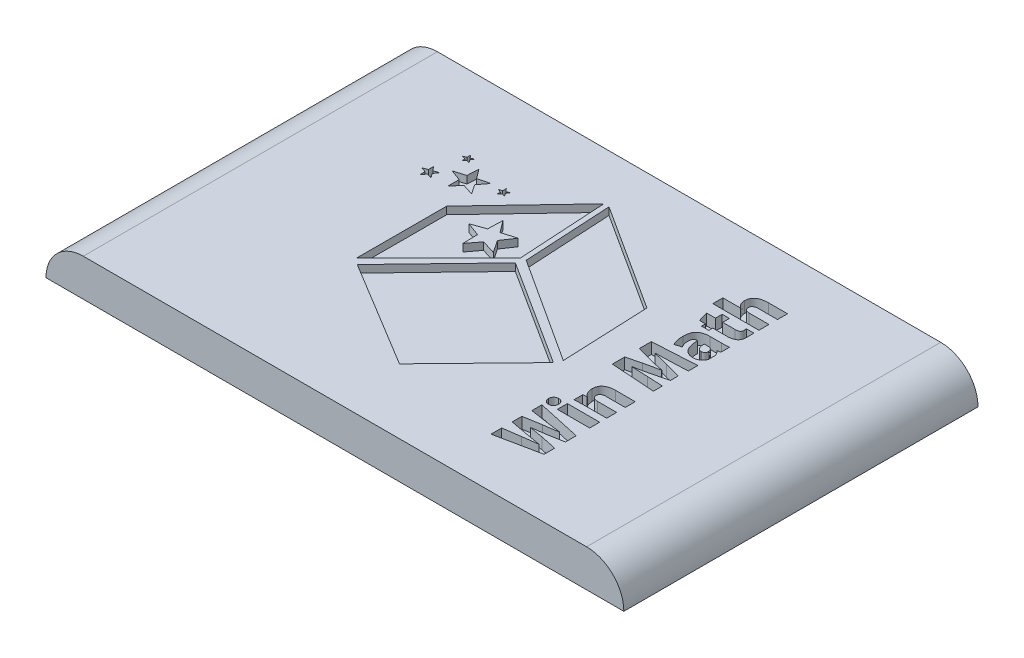
from build123d import *

# Parameters (mm, degrees)
SKETCH1_W           = 155
SKETCH1_H           = 95
BOSS_EXTRUDE1_DEPTH = 10
FILLET1_R           = 10
SHELL2_T            = -4
CUT_EXTRUDE2_DEPTH  = 2
SKETCH10_W          = 8.665288581
SKETCH10_H          = 2.686774754
CUT_EXTRUDE4_DEPTH  = 3
SKETCH15_W          = 8.5
SKETCH15_H          = 2.5
BOSS_EXTRUDE4_DEPTH = 8


with BuildPart() as part:
    # Sketch1 → Boss-Extrude1 (new body)
    with BuildSketch(Plane(origin=(0, 0, 0), x_dir=(1, 0, 0), z_dir=(0, 1, 0))):
        with Locations((77.5, 47.5)):
            Rectangle(SKETCH1_W, SKETCH1_H)
    extrude(amount=BOSS_EXTRUDE1_DEPTH)

    # Fillet1
    fillet1_edges = [part.edges().sort_by_distance(p)[0] for p in [
        (0, 10, -47.5),
        (155, 10, -47.5),
    ]]
    fillet(fillet1_edges, radius=FILLET1_R - 0.0001)  # a hair under: the kernel refuses the full size

    # Shell2
    shell2_openings = [part.faces().sort_by_distance(p)[0] for p in [
        (77.5, 0, -47.5),
    ]]
    offset(amount=SHELL2_T, openings=shell2_openings, kind=Kind.INTERSECTION)

    # Sketch3 → Cut-Extrude2 (cut)
    # profile 1 of 7: a face of its own
    with BuildSketch(Plane(origin=(0, 10, 0), x_dir=(1, 0, 0), z_dir=(0, 1, 0))):
        Polygon((69.036733179, 58.259922124), (67.638125215, 81.983150461), (47.110875028, 60.376853373), (47.083310819, 36.243745248), align=None)
        Polygon((60.375139911, 61.38680599), (58.007558121, 64.596933768), (57.882600374, 60.574029348), (54.174295459, 59.25664392), (57.866061848, 57.891664292), (57.941771542, 53.867289781), (60.348494509, 57.046729406), (64.103658579, 55.876904377), (61.899073145, 59.206844583), (64.144269846, 62.508118011), align=None, mode=Mode.SUBTRACT)
    # profile 2 of 7: a face of its own
    with BuildSketch(Plane(origin=(0, 10, 0), x_dir=(1, 0, 0), z_dir=(0, 1, 0))):
        Polygon((97.7621304, 38.336052471), (69.493012718, 56.405769666), (48.678543473, 34.808385006), (77.418274083, 17.397360525), align=None)
    # profile 3 of 7: a face of its own
    with BuildSketch(Plane(origin=(0, 10, 0), x_dir=(1, 0, 0), z_dir=(0, 1, 0))):
        Polygon((97.616775138, 63.57760932), (69.036733179, 81.982047892), (70.347319435, 58.462059656), (98.617355923, 40.151431275), align=None)
    # profile 4 of 7: a face of its own
    with BuildSketch(Plane(origin=(0, 10, 0), x_dir=(1, 0, 0), z_dir=(0, 1, 0))):
        Polygon((38.36475152, 67.166469328), (37.026417293, 66.737570237), (36.147854072, 67.834441993), (36.142157469, 66.429218619), (34.827528462, 65.932327812), (36.162371222, 65.492770559), (36.228525324, 64.089017277), (37.059126821, 65.222641311), (38.414734619, 64.85181082), (37.59313743, 65.992050265), align=None)
    # profile 5 of 7: a face of its own
    with BuildSketch(Plane(origin=(0, 10, 0), x_dir=(1, 0, 0), z_dir=(0, 1, 0))):
        Polygon((39.932787488, 75.007200453), (39.063779859, 74.697011221), (38.463798911, 75.398060936), (38.49007679, 74.475762504), (37.63797521, 74.12183806), (38.523337602, 73.861815689), (38.596658398, 72.942089916), (39.117438186, 73.70359713), (40.01492883, 73.489147584), (39.451516399, 74.219966644), align=None)
    # profile 6 of 7: a face of its own
    with BuildSketch(Plane(origin=(0, 10, 0), x_dir=(1, 0, 0), z_dir=(0, 1, 0))):
        Polygon((47.773334851, 71.559101671), (44.716464075, 70.785833729), (42.872969779, 73.252830432), (42.69380242, 70.220583683), (39.682136947, 69.298101489), (42.628199603, 68.197370744), (42.610558509, 65.160162438), (44.610433751, 67.51230827), (47.611257302, 66.557484071), (45.901173777, 69.111767437), align=None)
    # profile 7 of 7: a face of its own
    with BuildSketch(Plane(origin=(0, 10, 0), x_dir=(1, 0, 0), z_dir=(0, 1, 0))):
        Polygon((52.540289151, 71.996453787), (51.629200164, 71.701332989), (51.028116647, 72.447036723), (51.027014078, 71.489272342), (50.132096093, 71.148027435), (51.042633797, 70.851069023), (51.09059552, 69.894590972), (51.654375475, 70.668777721), (52.579062805, 70.418678465), (52.016936703, 71.194151544), align=None)
    extrude(amount=-CUT_EXTRUDE2_DEPTH, mode=Mode.SUBTRACT)

    # Sketch10 → Cut-Extrude4 (cut)
    # profile 1 of 8: a face of its own
    with BuildSketch(Plane(origin=(0, 10, 0), x_dir=(1, 0, 0), z_dir=(0, 1, 0))):
        with BuildLine():
            Line((109.792253149, 20.176323529), (109.79434915, 20.208015488))
            add(Edge.make_bspline(
                [(109.79434915, 20.208015488), (110.455705602, 20.281837374), (111.701269567, 20.424818801), (112.938874379, 20.625319094), (113.517703543, 20.727912603)],
                knots=[0, 0, 0, 0, 0.530977497, 1, 1, 1, 1], degree=3))
            Line((113.517703543, 20.727912603), (117.821434976, 21.525285399))
            Line((117.821434976, 21.525285399), (117.821434976, 24.404898692))
            Line((117.821434976, 24.404898692), (106.024546087, 26.993337369))
            Line((106.024546087, 26.993337369), (106.024546087, 24.297679048))
            Line((106.024546087, 24.297679048), (110.60316198, 23.593092817))
            add(Edge.make_bspline(
                [(110.60316198, 23.593092817), (111.28756685, 23.486706293), (112.663408575, 23.281734449), (114.044582989, 23.116263812), (114.738761612, 23.041028071)],
                knots=[0, 0, 0, 0, 0.497983353, 1, 1, 1, 1], degree=3))
            Line((114.738761612, 23.041028071), (114.738789849, 22.995726229))
            add(Edge.make_bspline(
                [(114.738789849, 22.995726229), (114.055513772, 22.92090247), (112.703388907, 22.754808184), (111.358226834, 22.539672346), (110.693033692, 22.427162812)],
                knots=[0, 0, 0, 0, 0.504666049, 1, 1, 1, 1], degree=3))
            Line((110.693033692, 22.427162812), (106.024546087, 21.632505042))
            Line((106.024546087, 21.632505042), (106.024546087, 19.028599405))
            Line((106.024546087, 19.028599405), (110.60316198, 18.170842253))
            add(Edge.make_bspline(
                [(110.60316198, 18.170842253), (111.304504593, 18.031314883), (112.690614667, 17.778181648), (114.081120008, 17.550417142), (114.767675556, 17.449516256)],
                knots=[0, 0, 0, 0, 0.507508313, 1, 1, 1, 1], degree=3))
            Line((114.767675556, 17.449516256), (114.769311088, 17.420304746))
            add(Edge.make_bspline(
                [(114.769311088, 17.420304746), (114.089540121, 17.329446689), (112.708978219, 17.164177801), (111.33035263, 16.983234878), (110.632981656, 16.882358136)],
                knots=[0, 0, 0, 0, 0.493234208, 1, 1, 1, 1], degree=3))
            Line((110.632981656, 16.882358136), (106.024546087, 16.210254479))
            Line((106.024546087, 16.210254479), (106.024546087, 13.345958277))
            Line((106.024546087, 13.345958277), (117.821434976, 15.781375903))
            Line((117.821434976, 15.781375903), (117.821434976, 18.630355013))
            Line((117.821434976, 18.630355013), (113.533200913, 19.53406344))
            add(Edge.make_bspline(
                [(113.533200913, 19.53406344), (112.944916379, 19.658403301), (111.700237893, 19.887823747), (110.448822737, 20.076287318), (109.792253149, 20.176323529)],
                knots=[0, 0, 0, 0, 0.475130786, 1, 1, 1, 1], degree=3))
        make_face()
    # profile 2 of 8: a face of its own
    with BuildSketch(Plane(origin=(0, 10, 0), x_dir=(1, 0, 0), z_dir=(0, 1, 0))):
        with Locations((113.488790686, 29.350939085)):
            Rectangle(SKETCH10_W, SKETCH10_H)
    # profile 3 of 8: a face of its own
    with BuildSketch(Plane(origin=(0, 10, 0), x_dir=(1, 0, 0), z_dir=(0, 1, 0))):
        with BuildLine():
            add(Edge.make_bspline(
                [(106.805220386, 27.976415787), (106.986061008, 27.977822156), (107.253592713, 28.023648032), (107.567661556, 28.187355383), (107.765897596, 28.353565551), (107.929362554, 28.556446918), (108.094524678, 28.881879168), (108.138027835, 29.160217386), (108.141934229, 29.348716021)],
                knots=[0, 0, 0, 0, 0.253740779, 0.372231841, 0.492472327, 0.613664901, 0.734924241, 1, 1, 1, 1], degree=3))
            add(Edge.make_bspline(
                [(108.141934229, 29.348716021), (108.13880655, 29.533270492), (108.096944726, 29.807520735), (107.935431471, 30.129362769), (107.776703927, 30.335314971), (107.581541982, 30.506119997), (107.263310189, 30.674196047), (106.990549885, 30.720387643), (106.805220386, 30.723240406)],
                knots=[0, 0, 0, 0, 0.25927437, 0.379931763, 0.500522204, 0.621179596, 0.740025125, 1, 1, 1, 1], degree=3))
            Line((106.805220386, 30.723240406), (106.805974077, 30.725073591))
            add(Edge.make_bspline(
                [(106.805974077, 30.725073591), (106.619769652, 30.722432926), (106.345614811, 30.676852306), (106.02365478, 30.513527127), (105.824394706, 30.346684429), (105.66369677, 30.142401273), (105.496623558, 29.817909321), (105.459349625, 29.537012114), (105.455161646, 29.348716021)],
                knots=[0, 0, 0, 0, 0.2589006, 0.37811166, 0.497229398, 0.61664906, 0.736776138, 1, 1, 1, 1], degree=3))
            add(Edge.make_bspline(
                [(105.455161646, 29.348716021), (105.457261626, 29.163239942), (105.49996557, 28.887414163), (105.662821208, 28.56419842), (105.825122001, 28.359638182), (106.023423767, 28.190763568), (106.344476473, 28.023833767), (106.619622842, 27.980368616), (106.805220386, 27.976415787)],
                knots=[0, 0, 0, 0, 0.259051438, 0.380497729, 0.500313379, 0.62048887, 0.740571173, 1, 1, 1, 1], degree=3))
        make_face()
    # profile 4 of 8: a face of its own
    with BuildSketch(Plane(origin=(0, 10, 0), x_dir=(1, 0, 0), z_dir=(0, 1, 0))):
        with BuildLine():
            add(Edge.make_bspline(
                [(112.675048454, 35.249384615), (112.545592685, 35.254083647), (112.358164524, 35.266459945), (112.11897095, 35.30773926), (111.962345757, 35.353847084), (111.817654345, 35.402802292), (111.69014682, 35.467985533), (111.578160491, 35.544444168), (111.449077873, 35.65508887), (111.322618833, 35.813202152), (111.168692328, 36.08130507), (111.127177909, 36.310044681), (111.131191142, 36.459321937)],
                knots=[0, 0, 0, 0, 0.176160203, 0.255052732, 0.32940979, 0.397964722, 0.462432765, 0.523384479, 0.581990358, 0.692990545, 0.796775826, 1, 1, 1, 1], degree=3))
            add(Edge.make_bspline(
                [(111.131191142, 36.459321937), (111.130080554, 36.551719086), (111.149455225, 36.685474085), (111.196776502, 36.854289303), (111.245508535, 36.966210513), (111.309199314, 37.066906868), (111.388244937, 37.15484283), (111.476493028, 37.236832085), (111.618621342, 37.326092923), (111.819718874, 37.417224497), (112.198755715, 37.526849864), (112.508141007, 37.544872591), (112.721458026, 37.542482738)],
                knots=[0, 0, 0, 0, 0.126622383, 0.185047078, 0.240764724, 0.293960579, 0.34817347, 0.403063393, 0.459078996, 0.578190241, 0.705688236, 1, 1, 1, 1], degree=3))
            Line((112.721458026, 37.542482738), (117.821434976, 37.544704716))
            Line((117.821434976, 37.544704716), (117.821434976, 40.231477298))
            Line((117.821434976, 40.231477298), (112.542342316, 40.231477298))
            add(Edge.make_bspline(
                [(112.542342316, 40.231477298), (112.271694274, 40.228814628), (111.876870415, 40.210287954), (111.371079382, 40.135138358), (111.03008149, 40.056916336), (110.713406466, 39.960581933), (110.423877439, 39.836935416), (110.157264958, 39.695648606), (109.917397892, 39.53021761), (109.705813967, 39.343075167), (109.520504268, 39.136145519), (109.364113599, 38.908243319), (109.236530712, 38.658276513), (109.136734704, 38.38879388), (109.038695349, 37.991714977), (109.016212867, 37.678195288), (109.013800828, 37.464637506)],
                knots=[0, 0, 0, 0, 0.159329229, 0.232136671, 0.30061145, 0.365052216, 0.426635428, 0.485584623, 0.542342679, 0.597667459, 0.65143417, 0.705405814, 0.759844481, 0.816166583, 0.874152162, 1, 1, 1, 1], degree=3))
            add(Edge.make_bspline(
                [(109.013800828, 37.464637506), (109.020960497, 37.176646894), (109.068776347, 36.758517506), (109.228474953, 36.239449525), (109.393422488, 35.90820579), (109.582351423, 35.619084927), (109.837026659, 35.296892327), (110.051657569, 35.092358342), (110.210393253, 34.989159125)],
                knots=[0, 0, 0, 0, 0.302903009, 0.439447221, 0.568754019, 0.690453447, 0.80194042, 1, 1, 1, 1], degree=3))
            Line((110.210393253, 34.989159125), (110.211238169, 34.943944164))
            Line((110.211238169, 34.943944164), (109.156146395, 34.806559493))
            Line((109.156146395, 34.806559493), (109.156146395, 32.501115603))
            add(Edge.make_bspline(
                [(109.156146395, 32.501115603), (109.590425563, 32.519694425), (110.513312872, 32.549172218), (111.436628561, 32.556742971), (111.925212509, 32.560387883)],
                knots=[0, 0, 0, 0, 0.470792845, 1, 1, 1, 1], degree=3))
            Line((111.925212509, 32.560387883), (117.821434976, 32.562609861))
            Line((117.821434976, 32.562609861), (117.821434976, 35.249384615))
            Line((117.821434976, 35.249384615), (112.675048454, 35.249384615))
        make_face()
    # profile 5 of 8: a face of its own
    with BuildSketch(Plane(origin=(0, 10, 0), x_dir=(1, 0, 0), z_dir=(0, 1, 0))):
        with BuildLine():
            Line((109.26735387, 54.147982822), (109.267358214, 54.194844175))
            add(Edge.make_bspline(
                [(109.267358214, 54.194844175), (110.031851514, 54.183899405), (110.979533008, 54.199987074), (112.102462916, 54.236006327), (112.791228623, 54.263308822), (113.297002921, 54.281479358), (113.626686868, 54.301449137)],
                knots=[0, 0, 0, 0, 0.525845663, 0.651876005, 0.772827643, 1, 1, 1, 1], degree=3))
            Line((113.626686868, 54.301449137), (117.821434976, 54.471568337))
            Line((117.821434976, 54.471568337), (117.821434976, 57.023580049))
            Line((117.821434976, 57.023580049), (106.024546087, 56.34714321))
            Line((106.024546087, 56.34714321), (106.024546087, 53.087947529))
            Line((106.024546087, 53.087947529), (109.824870388, 52.073292269))
            add(Edge.make_bspline(
                [(109.824870388, 52.073292269), (110.529476101, 51.888337292), (111.939558008, 51.555824805), (113.358062051, 51.261204048), (114.067068467, 51.134260265)],
                knots=[0, 0, 0, 0, 0.50283341, 1, 1, 1, 1], degree=3))
            Line((114.067068467, 51.134260265), (114.067322593, 51.074010575))
            add(Edge.make_bspline(
                [(114.067322593, 51.074010575), (113.362421965, 50.946770089), (111.946456926, 50.673341755), (110.543177199, 50.340924297), (109.838960289, 50.166755237)],
                knots=[0, 0, 0, 0, 0.496826679, 1, 1, 1, 1], degree=3))
            Line((109.838960289, 50.166755237), (106.024546087, 49.213809266))
            Line((106.024546087, 49.213809266), (106.024546087, 45.908492891))
            Line((106.024546087, 45.908492891), (117.821434976, 45.093693971))
            Line((117.821434976, 45.093693971), (117.821434976, 47.522717167))
            Line((117.821434976, 47.522717167), (113.624764629, 47.722573506))
            add(Edge.make_bspline(
                [(113.624764629, 47.722573506), (113.291081067, 47.739633209), (112.778701358, 47.76442947), (112.079445197, 47.796373432), (110.960834778, 47.845039884), (110.020772475, 47.882729754), (109.26735387, 47.907019356)],
                knots=[0, 0, 0, 0, 0.229826594, 0.352856511, 0.481490482, 1, 1, 1, 1], degree=3))
            Line((109.26735387, 47.907019356), (109.267358214, 47.953176974))
            add(Edge.make_bspline(
                [(109.267358214, 47.953176974), (110.00310407, 48.078921568), (110.915641298, 48.251507349), (111.99256358, 48.48470057), (112.647171752, 48.633870138), (113.122429657, 48.750419415), (113.428737564, 48.827817245)],
                knots=[0, 0, 0, 0, 0.526467698, 0.654878301, 0.777163486, 1, 1, 1, 1], degree=3))
            Line((113.428737564, 48.827817245), (117.608728961, 49.890246106))
            Line((117.608728961, 49.890246106), (117.608728961, 51.934930189))
            Line((117.608728961, 51.934930189), (113.40018852, 53.103321093))
            add(Edge.make_bspline(
                [(113.40018852, 53.103321093), (113.09218646, 53.187583927), (112.618236743, 53.322253707), (111.964176369, 53.494922928), (110.897489299, 53.770856536), (109.994492018, 53.987285463), (109.26735387, 54.147982822)],
                knots=[0, 0, 0, 0, 0.224698707, 0.3466845, 0.476000013, 1, 1, 1, 1], degree=3))
        make_face()
    # profile 6 of 8: a face of its own
    with BuildSketch(Plane(origin=(0, 10, 0), x_dir=(1, 0, 0), z_dir=(0, 1, 0))):
        with BuildLine():
            Line((117.830329402, 59.932627318), (117.830329402, 61.650844989))
            add(Edge.make_bspline(
                [(117.830329402, 61.650844989), (117.82532285, 61.669162698), (117.79066929, 61.791216765), (117.711394308, 62.011134496), (117.572338443, 62.300375877), (117.335480737, 62.65702212), (117.105348287, 62.884043774), (116.936221307, 63.015666834)],
                knots=[0.36328456, 0.36328456, 0.36328456, 0.36328456, 0.385125259, 0.509211321, 0.631645188, 0.753459676, 1, 1, 1, 1], degree=3))
            Line((116.936221307, 63.015666834), (116.937316006, 63.060781882))
            Line((116.937316006, 63.060781882), (117.821434976, 63.20958704))
            Line((117.821434976, 63.20958704), (117.821434976, 65.565004789))
            add(Edge.make_bspline(
                [(117.821434976, 65.565004789), (117.677748996, 65.532163273), (117.45008879, 65.505542481), (117.136179932, 65.468259837), (116.592709894, 65.435339063), (116.13058889, 65.423049614), (115.755197929, 65.424420731)],
                knots=[0, 0, 0, 0, 0.212741013, 0.331399044, 0.457156632, 1, 1, 1, 1], degree=3))
            Line((115.755197929, 65.424420731), (112.694555374, 65.426642708))
            add(Edge.make_bspline(
                [(112.694555374, 65.426642708), (112.452530809, 65.434159901), (112.095692675, 65.418463568), (111.631074397, 65.354689924), (111.303177964, 65.27682039), (110.986496412, 65.18126981), (110.684928813, 65.055097347), (110.397210759, 64.905288847), (110.121697305, 64.73348242), (109.867107918, 64.527318082), (109.647017857, 64.275450648), (109.458671366, 63.983410388), (109.306707721, 63.647419935), (109.181476391, 63.272095723), (109.058022402, 62.690464358), (109.019301911, 62.228346234), (109.013800828, 61.908040389)],
                knots=[0, 0, 0, 0, 0.124012428, 0.182748926, 0.240082173, 0.296571819, 0.352108958, 0.407344988, 0.462689397, 0.518300585, 0.574566128, 0.633380012, 0.695774865, 0.763066447, 0.835812544, 1, 1, 1, 1], degree=3))
            add(Edge.make_bspline(
                [(109.013800828, 61.908040389), (109.015679391, 61.553365409), (109.04899114, 61.042265614), (109.147480471, 60.392925131), (109.248703859, 59.971983886), (109.362089165, 59.598130719), (109.505831819, 59.190259845), (109.628820673, 58.914352892), (109.721080366, 58.751972264)],
                knots=[0, 0, 0, 0, 0.325720809, 0.469837241, 0.602829046, 0.723064519, 0.828626239, 1, 1, 1, 1], degree=3))
            Line((109.721080366, 58.751972264), (111.440382673, 59.232529735))
            add(Edge.make_bspline(
                [(111.440382673, 59.232529735), (111.345896835, 59.370851893), (111.23077079, 59.600112903), (111.095386116, 59.921160043), (111.009948317, 60.184042204), (110.937641611, 60.459169621), (110.870383654, 60.848191013), (110.844604617, 61.147145077), (110.846500007, 61.349778867)],
                knots=[0, 0, 0, 0, 0.224854409, 0.344804783, 0.468872013, 0.596717397, 0.727529605, 1, 1, 1, 1], degree=3))
            add(Edge.make_bspline(
                [(110.846500007, 61.349778867), (110.845002059, 61.478683355), (110.861151736, 61.662658777), (110.891071404, 61.897924383), (110.931159349, 62.048638001), (110.973011064, 62.185646734), (111.029930066, 62.304432794), (111.093366386, 62.408010559), (111.192659926, 62.521254593), (111.338539735, 62.632903288), (111.612852236, 62.763799334), (111.846481484, 62.791396093), (112.003057741, 62.784355287)],
                knots=[0, 0, 0, 0, 0.18180892, 0.261271409, 0.334748632, 0.4020433, 0.463473156, 0.520477115, 0.573236162, 0.675566172, 0.777783362, 1, 1, 1, 1], degree=3))
            add(Edge.make_bspline(
                [(112.003057741, 62.784355287), (112.005872912, 62.46598577), (112.023717046, 61.997030976), (112.108619723, 61.391142913), (112.194973938, 60.968982144), (112.306268574, 60.569840406), (112.440935677, 60.191899637), (112.605122928, 59.838466836), (112.786577984, 59.50514766), (113.000190998, 59.204598774), (113.241166768, 58.937890227), (113.515870857, 58.714056161), (113.818406976, 58.528712685), (114.148966602, 58.379619268), (114.643171298, 58.235640091), (115.03666983, 58.189485659), (115.305919732, 58.182589995)],
                knots=[0, 0, 0, 0, 0.149723135, 0.220091132, 0.287334086, 0.352092728, 0.414697941, 0.475660325, 0.535089834, 0.592810356, 0.64854798, 0.703513505, 0.758732465, 0.814879192, 0.873418456, 1, 1, 1, 1], degree=3))
            add(Edge.make_bspline(
                [(115.305919732, 58.182589995), (115.483525464, 58.182696346), (115.7454589, 58.208803996), (116.084043465, 58.2822751), (116.32203826, 58.361803657), (116.551122913, 58.456351589), (116.767016043, 58.575698198), (116.973510996, 58.713648069), (117.164661403, 58.874143678), (117.344815122, 59.047430592), (117.496920086, 59.243687236), (117.632943394, 59.450284264), (117.741011701, 59.674578232), (117.801481723, 59.837925101), (117.828140388, 59.92532548), (117.830329402, 59.932627318)],
                knots=[0, 0, 0, 0, 0.130267071, 0.192750794, 0.254048942, 0.314320404, 0.374505722, 0.434912302, 0.496401197, 0.55761949, 0.618080033, 0.678341656, 0.738976024, 0.800474561, 0.806071913, 0.806071913, 0.806071913, 0.806071913], degree=3))
        make_face()
        with BuildLine():
            add(Edge.make_bspline(
                [(114.998987103, 60.72924116), (114.885701581, 60.734976325), (114.717911461, 60.752195692), (114.514427454, 60.828817609), (114.376709031, 60.895835623), (114.254805659, 60.987877229), (114.146278605, 61.096420323), (114.050832911, 61.223563923), (113.944614143, 61.420483832), (113.840446456, 61.69772586), (113.712599355, 62.199880454), (113.691620967, 62.603730108), (113.693411353, 62.879993715)],
                knots=[0, 0, 0, 0, 0.121062784, 0.176330044, 0.230178356, 0.28306346, 0.337597475, 0.392685149, 0.451159481, 0.574502558, 0.706010805, 1, 1, 1, 1], degree=3))
            Line((113.693411353, 62.879993715), (114.802152045, 62.882215693))
            add(Edge.make_bspline(
                [(114.802152045, 62.882215693), (114.980226975, 62.873449849), (115.243734036, 62.833107212), (115.537963673, 62.661356786), (115.706796163, 62.496656244), (115.836916364, 62.307447966), (115.963373397, 62.037327168), (116.00504686, 61.817266342), (116.002078522, 61.670056393)],
                knots=[0, 0, 0, 0, 0.283588896, 0.408331003, 0.531556683, 0.652548379, 0.76868481, 1, 1, 1, 1], degree=3))
            add(Edge.make_bspline(
                [(116.002078522, 61.670056393), (116.003987112, 61.54945225), (115.976701469, 61.368880763), (115.87311336, 61.15239919), (115.765266924, 61.00877971), (115.625868827, 60.884314351), (115.371497374, 60.7628411), (115.151911641, 60.732085831), (114.998987103, 60.72924116)],
                knots=[0, 0, 0, 0, 0.233316155, 0.346154559, 0.460826239, 0.578678938, 0.703680602, 1, 1, 1, 1], degree=3))
        make_face(mode=Mode.SUBTRACT)
    # profile 7 of 8: a face of its own
    with BuildSketch(Plane(origin=(0, 10, 0), x_dir=(1, 0, 0), z_dir=(0, 1, 0))):
        with BuildLine():
            Line((117.830329402, 69.494003369), (117.830329402, 71.871472104))
            add(Edge.make_bspline(
                [(117.830329402, 71.871472104), (117.813971873, 71.945847501), (117.795064678, 72.019648169), (117.772501515, 72.092420898)],
                knots=[0.863627378, 0.863627378, 0.863627378, 0.863627378, 1, 1, 1, 1], degree=3))
            Line((117.772501515, 72.092420898), (115.768130142, 72.078572092))
            add(Edge.make_bspline(
                [(115.768130142, 72.078572092), (115.798980854, 71.971923839), (115.837666935, 71.73596045), (115.847036165, 71.497274807), (115.846388058, 71.369572314)],
                knots=[0, 0, 0, 0, 0.46450099, 1, 1, 1, 1], degree=3))
            add(Edge.make_bspline(
                [(115.846388058, 71.369572314), (115.847714379, 71.226778141), (115.819360969, 71.012732748), (115.677414747, 70.773787831), (115.527842029, 70.633433443), (115.32996932, 70.523996756), (114.963833754, 70.419850277), (114.655639859, 70.404205268), (114.436277282, 70.402067287)],
                knots=[0, 0, 0, 0, 0.220466897, 0.319825893, 0.42026354, 0.531155521, 0.663033745, 1, 1, 1, 1], degree=3))
            Line((114.436277282, 70.402067287), (111.119892288, 70.402853558))
            Line((111.119892288, 70.402853558), (111.119892288, 72.201560609))
            Line((111.119892288, 72.201560609), (109.167449593, 72.201560609))
            Line((109.167449593, 72.201560609), (109.167449593, 70.402853558))
            Line((109.167449593, 70.402853558), (106.830667784, 70.402853558))
            Line((106.830667784, 70.402853558), (107.583972446, 67.72785333))
            Line((107.583972446, 67.72785333), (109.167449593, 67.72785333))
            Line((109.167449593, 67.72785333), (109.167449593, 66.667077377))
            Line((109.167449593, 66.667077377), (111.119892288, 66.667077377))
            Line((111.119892288, 66.667077377), (111.119892288, 67.72785333))
            Line((111.119892288, 67.72785333), (114.782080399, 67.72785333))
            add(Edge.make_bspline(
                [(114.782080399, 67.72785333), (114.929524773, 67.712993227), (115.156318754, 67.711036924), (115.463154096, 67.737951372), (115.705563626, 67.772921799), (115.955356677, 67.827885895), (116.213083184, 67.89627108), (116.478226134, 67.982643287), (116.749448629, 68.077717579), (117.015212817, 68.203245407), (117.246594075, 68.390157991), (117.449673238, 68.616800922), (117.617231153, 68.89288097), (117.744510126, 69.189101835), (117.805847459, 69.396546268), (117.830329402, 69.494003369)],
                knots=[0, 0, 0, 0, 0.092256522, 0.140940269, 0.191833595, 0.244747776, 0.300215789, 0.357923926, 0.418428452, 0.479374026, 0.539906763, 0.602401374, 0.66816552, 0.740167715, 0.802735676, 0.802735676, 0.802735676, 0.802735676], degree=3))
        make_face()
    # profile 8 of 8: a face of its own
    with BuildSketch(Plane(origin=(0, 10, 0), x_dir=(1, 0, 0), z_dir=(0, 1, 0))):
        with BuildLine():
            add(Edge.make_bspline(
                [(112.534692458, 76.102562427), (112.396961676, 76.105752265), (112.201516638, 76.131337544), (111.95394496, 76.17884297), (111.79923348, 76.235687202), (111.660136527, 76.294519902), (111.543043421, 76.371682916), (111.44511494, 76.459264727), (111.345586464, 76.58759909), (111.253905068, 76.751209937), (111.152784775, 76.988355299), (111.121393432, 77.168829507), (111.131191142, 77.281361656)],
                knots=[0, 0, 0, 0, 0.199072936, 0.285916643, 0.364427617, 0.437537896, 0.504306979, 0.566694354, 0.627116203, 0.738821573, 0.837610921, 1, 1, 1, 1], degree=3))
            add(Edge.make_bspline(
                [(111.131191142, 77.281361656), (111.134348963, 77.3769622), (111.149346484, 77.516263215), (111.201403511, 77.690806385), (111.25452731, 77.806138382), (111.322132525, 77.910841386), (111.405551896, 78.002193852), (111.502013485, 78.083103854), (111.652020994, 78.176308905), (111.867818714, 78.269223661), (112.273809607, 78.376145743), (112.602527381, 78.400953255), (112.830441351, 78.39566055)],
                knots=[0, 0, 0, 0, 0.124912577, 0.181512685, 0.236901733, 0.290014955, 0.343426716, 0.397663921, 0.453741058, 0.573247763, 0.702518624, 1, 1, 1, 1], degree=3))
            Line((112.830441351, 78.39566055), (117.821434976, 78.397882527))
            Line((117.821434976, 78.397882527), (117.821434976, 81.08465511))
            Line((117.821434976, 81.08465511), (112.742850261, 81.08465511))
            add(Edge.make_bspline(
                [(112.742850261, 81.08465511), (112.458700497, 81.082678282), (112.044891365, 81.062139146), (111.513729789, 80.990247824), (111.154394318, 80.915346068), (110.821554673, 80.816849713), (110.514259775, 80.700396344), (110.233161227, 80.561544678), (109.97909197, 80.40204139), (109.752704208, 80.220981237), (109.554910666, 80.020323073), (109.389702997, 79.797899699), (109.252424933, 79.557692686), (109.145213662, 79.298460814), (109.042460828, 78.917533118), (109.012977969, 78.616517798), (109.013800828, 78.411229596)],
                knots=[0, 0, 0, 0, 0.164293392, 0.239153132, 0.309681376, 0.376270675, 0.439631136, 0.49943574, 0.557226677, 0.612718082, 0.66666855, 0.719644876, 0.772435353, 0.826242616, 0.881351993, 1, 1, 1, 1], degree=3))
            add(Edge.make_bspline(
                [(109.013800828, 78.411229596), (109.007731104, 78.223721098), (109.038394107, 77.937091666), (109.135269394, 77.557239833), (109.241754925, 77.261015634), (109.387167702, 76.962310991), (109.667156697, 76.564765851), (109.933503402, 76.298437118), (110.132548021, 76.13370052)],
                knots=[0, 0, 0, 0, 0.213675423, 0.327185579, 0.44685142, 0.572508298, 0.705144805, 1, 1, 1, 1], degree=3))
            Line((110.132548021, 76.13370052), (110.1345137, 76.102562427))
            Line((110.1345137, 76.102562427), (105.455163818, 76.102562427))
            Line((105.455163818, 76.102562427), (105.455163818, 73.415787672))
            Line((105.455163818, 73.415787672), (117.821434976, 73.415787672))
            Line((117.821434976, 73.415787672), (117.821434976, 76.102562427))
            Line((117.821434976, 76.102562427), (112.534692458, 76.102562427))
        make_face()
    extrude(amount=-CUT_EXTRUDE4_DEPTH, mode=Mode.SUBTRACT)

    # Sketch15 → Boss-Extrude4 (add)
    with BuildSketch(Plane.XZ.offset(-6)):
        with Locations((35.75, -68.25)):
            Rectangle(SKETCH15_W, SKETCH15_H)
        with Locations((35.75, -26.75)):
            Rectangle(SKETCH15_W, SKETCH15_H)
        with Locations((119.25, -26.75)):
            Rectangle(SKETCH15_W, SKETCH15_H)
        with Locations((119.25, -68.25)):
            Rectangle(SKETCH15_W, SKETCH15_H)
    extrude(amount=BOSS_EXTRUDE4_DEPTH)


solid = part.part
